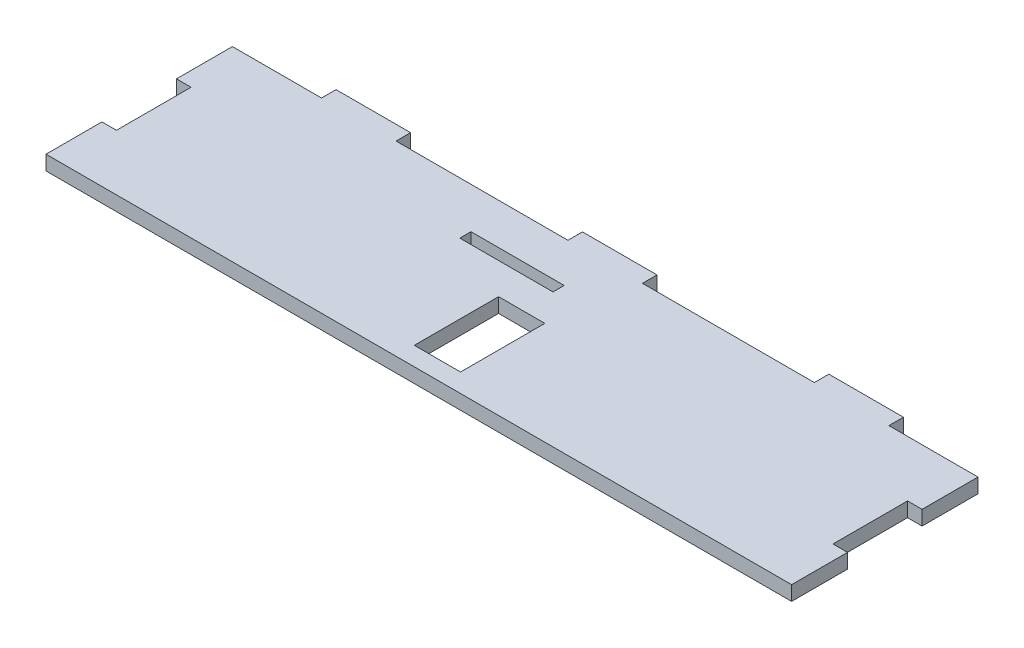
from build123d import *

# Parameters (mm, degrees)
SKETCH1_W           = 25
SKETCH1_H           = 3
BOSS_EXTRUDE1_DEPTH = 3.9
SKETCH1_3_W         = 12.4
SKETCH1_3_H         = 22.6
CUT_EXTRUDE3_DEPTH  = 105.165349325


with BuildPart() as part:
    # Sketch1 → Boss-Extrude1 (new body)
    with BuildSketch(Plane(origin=(0, 0, 0), x_dir=(1, 0, 0), z_dir=(0, 1, 0))):
        Polygon((-76.1, 25), (-100, 25), (-100, 10), (-96.1, 10), (-96.1, -10), (-100, -10), (-100, -25), (100, -25), (100, -10), (96.1, -10), (96.1, 10), (100, 10), (100, 25), (76.1, 25), (76.1, 28.9), (56.1, 28.9), (56.1, 25), (10, 25), (10, 28.9), (-10, 28.9), (-10, 25), (-56.1, 25), (-56.1, 28.9), (-76.1, 28.9), align=None)
        with Locations((-12.5, 12.5)):
            Rectangle(SKETCH1_W, SKETCH1_H, mode=Mode.SUBTRACT)
    extrude(amount=BOSS_EXTRUDE1_DEPTH)

    # Sketch1<3> → Cut-Extrude3 (cut, through all)
    with BuildSketch(Plane(origin=(0, 0, 0), x_dir=(1, 0, 0), z_dir=(0, 1, 0))):
        with Locations((0, -8.7)):
            Rectangle(SKETCH1_3_W, SKETCH1_3_H)
    extrude(amount=CUT_EXTRUDE3_DEPTH, mode=Mode.SUBTRACT)


solid = part.part
